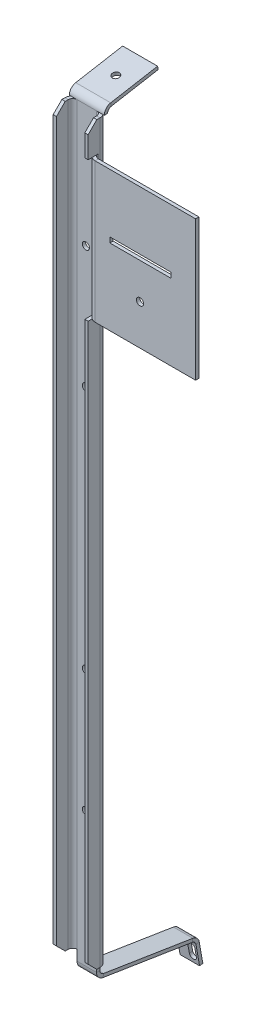
from build123d import *

# Parameters (mm, degrees)
SKETCH1_W                      = 20
SKETCH1_H                      = 425.14614931
BASE_FLANGE1_DEPTH             = 1.89738
EDGE_FLANGE1_START             = 74
EDGE_FLANGE1_DEPTH             = 20
EDGE_FLANGE1_2_DEPTH           = 20
EDGE_FLANGE3_STRIP_W           = 12.66952
EDGE_FLANGE3_STRIP_H           = 1.89738
EDGE_FLANGE3_STRIP_CUT_DEPTH   = 421.088186102
EDGE_FLANGE3_STRIP_2_W         = 12.66952
EDGE_FLANGE3_STRIP_2_H         = 1.89738
EDGE_FLANGE3_STRIP_CUT_2_DEPTH = 421.088186102
EDGE_FLANGE3_DEPTH             = 421.088186102
EDGE_FLANGE3_BEND_DEPTH        = 421.088186102
EDGE_FLANGE5_START             = 78.43738
EDGE_FLANGE5_DEPTH             = 11.12524
EDGE_FLANGE6_START             = 78.43738
EDGE_FLANGE6_DEPTH             = 11.12524
EDGE_FLANGE6_2_DEPTH           = 11.12524
SKETCH31_R                     = 2.04
CUT_EXTRUDE1_DEPTH             = 10
CUT_EXTRUDE2_DEPTH             = 3.21412
BREAK_CORNER1_START            = 74
BREAK_CORNER1_DEPTH            = 20
EDGE_FLANGE7_STRIP_W           = 14.16952
EDGE_FLANGE7_STRIP_H           = 1.89738
EDGE_FLANGE7_STRIP_CUT_DEPTH   = 80
EDGE_FLANGE7_DEPTH             = 80
SKETCH36_W                     = 35
SKETCH36_H                     = 3
CUT_EXTRUDE3_DEPTH             = 10
SKETCH37_R                     = 2.04
CUT_EXTRUDE4_DEPTH             = 10
SKETCH38_R                     = 2.04
CUT_EXTRUDE6_DEPTH             = 10


# Read off the part's stored shape, not the designer's step: Edge-Flange1, Edge-Flange5, Edge-Flange6, Break-Corner1
# Sheet-metal steps are written as plain solids
with BuildPart() as part:
    # Sketch1 → Base-Flange1 (new body)
    with BuildSketch(Plane.XY):
        with Locations((84, -2.062852184)):
            Rectangle(SKETCH1_W, SKETCH1_H)
    extrude(amount=-BASE_FLANGE1_DEPTH)

    # Edge-Flange1 outline → Edge-Flange1 (cut)
    with BuildSketch(Plane.YZ.offset(EDGE_FLANGE1_START)):
        with BuildLine():
            ThreePointArc((206.452259263, 0), (208.504014129, -0.502835143), (210.090767372, -1.89738))
            Line((210.090767372, -1.89738), (210.510222471, -1.89738))
            Line((210.510222471, -1.89738), (210.510222471, 0))
            Line((210.510222471, 0), (206.452259263, 0))
        make_face()
    extrude(amount=EDGE_FLANGE1_DEPTH, mode=Mode.SUBTRACT)

    # Edge-Flange1 2 outline → Edge-Flange1 2 (add)
    with BuildSketch(Plane.YZ.offset(EDGE_FLANGE1_START)):
        with BuildLine():
            Line((215.55374818, -30.500635662), (210.82222549, -3.666837049))
            ThreePointArc((210.82222549, -3.666837049), (210.553071361, -2.742186382), (210.090767372, -1.89738))
            Line((210.090767372, -1.89738), (206.452259263, -1.89738))
            ThreePointArc((206.452259263, -1.89738), (208.084939792, -2.491627114), (208.953670956, -3.996313629))
            Line((208.953670956, -3.996313629), (213.685193646, -30.830112242))
            Line((213.685193646, -30.830112242), (215.55374818, -30.500635662))
        make_face()
    extrude(amount=EDGE_FLANGE1_2_DEPTH)

    # Edge-Flange3 strip (across the edge) → Edge-Flange3 strip cut (cut)
    with BuildSketch(Plane(origin=(74, 206.452259263, 0), x_dir=(1, 0, 0), z_dir=(0, -1, 0))):
        with Locations((-1.89738, -0.94869)):
            Rectangle(EDGE_FLANGE3_STRIP_W, EDGE_FLANGE3_STRIP_H)
    extrude(amount=EDGE_FLANGE3_STRIP_CUT_DEPTH, mode=Mode.SUBTRACT)

    # Edge-Flange3 strip 2 (across the edge) → Edge-Flange3 strip cut 2 (cut)
    with BuildSketch(Plane(origin=(94, -214.635926839, 0), x_dir=(-1, 0, 0), z_dir=(0, 1, 0))):
        with Locations((-1.89738, -0.94869)):
            Rectangle(EDGE_FLANGE3_STRIP_2_W, EDGE_FLANGE3_STRIP_2_H)
    extrude(amount=EDGE_FLANGE3_STRIP_CUT_2_DEPTH, mode=Mode.SUBTRACT)

    # Edge-Flange3 section (across the edge) → Edge-Flange3 (add)
    with BuildSketch(Plane(origin=(74, 206.452259263, 0), x_dir=(1, 0, 0), z_dir=(0, -1, 0))):
        with BuildLine():
            Line((0, 2.54), (0, 9.26))
            Line((0, 9.26), (1.89738, 9.26))
            Line((1.89738, 9.26), (1.89738, 2.54))
            ThreePointArc((1.89738, 2.54), (2.641328776, 0.743948776), (4.43738, 0))
            Line((4.43738, 0), (4.43738, -1.89738))
            ThreePointArc((4.43738, -1.89738), (1.299678511, -0.597701489), (0, 2.54))
        make_face()
    extrude(amount=EDGE_FLANGE3_DEPTH)

    # Edge-Flange3 section 2 (across the edge) → Edge-Flange3 bend (add)
    with BuildSketch(Plane(origin=(94, -214.635926839, 0), x_dir=(-1, 0, 0), z_dir=(0, 1, 0))):
        with BuildLine():
            Line((0, 2.54), (0, 9.26))
            Line((0, 9.26), (1.89738, 9.26))
            Line((1.89738, 9.26), (1.89738, 2.54))
            ThreePointArc((1.89738, 2.54), (2.641328776, 0.743948776), (4.43738, 0))
            Line((4.43738, 0), (4.43738, -1.89738))
            ThreePointArc((4.43738, -1.89738), (1.299678511, -0.597701489), (0, 2.54))
        make_face()
    extrude(amount=EDGE_FLANGE3_BEND_DEPTH)

    # Edge-Flange5 outline → Edge-Flange5 (add)
    with BuildSketch(Plane.YZ.offset(EDGE_FLANGE5_START)):
        with BuildLine():
            ThreePointArc((-220.545530818, 0), (-223.427378599, -1.063169777), (-224.928279306, -3.743220834))
            Line((-224.928279306, -3.743220834), (-233.964581883, -60.796189915))
            Line((-233.964581883, -60.796189915), (-232.090561779, -61.09300554))
            Line((-232.090561779, -61.09300554), (-223.054259203, -4.040036459))
            ThreePointArc((-223.054259203, -4.040036459), (-222.195128861, -2.505948848), (-220.545530818, -1.89738))
            Line((-220.545530818, -1.89738), (-214.635926839, -1.89738))
            Line((-214.635926839, -1.89738), (-214.635926839, 0))
            Line((-214.635926839, 0), (-220.545530818, 0))
        make_face()
    extrude(amount=EDGE_FLANGE5_DEPTH)

    # Edge-Flange6 outline → Edge-Flange6 (cut)
    with BuildSketch(Plane.YZ.offset(EDGE_FLANGE6_START)):
        with BuildLine():
            ThreePointArc((-231.141243496, -55.099245789), (-231.958853079, -57.047079402), (-233.584451669, -58.3961422))
            Line((-233.584451669, -58.3961422), (-233.964581883, -60.796189915))
            Line((-233.964581883, -60.796189915), (-232.090561779, -61.09300554))
            Line((-232.090561779, -61.09300554), (-231.141243496, -55.099245789))
        make_face()
    extrude(amount=EDGE_FLANGE6_DEPTH, mode=Mode.SUBTRACT)

    # Edge-Flange6 2 outline → Edge-Flange6 2 (add)
    with BuildSketch(Plane.YZ.offset(EDGE_FLANGE6_START)):
        with BuildLine():
            Line((-246.408498712, -60.830152569), (-234.753449034, -58.775052849))
            ThreePointArc((-234.753449034, -58.775052849), (-234.155770092, -58.626260643), (-233.584451669, -58.3961422))
            Line((-233.584451669, -58.3961422), (-233.015263599, -54.802430164))
            ThreePointArc((-233.015263599, -54.802430164), (-233.712335844, -56.185396154), (-235.082925613, -56.906498315))
            Line((-235.082925613, -56.906498315), (-246.737975292, -58.961598035))
            Line((-246.737975292, -58.961598035), (-246.408498712, -60.830152569))
        make_face()
    extrude(amount=EDGE_FLANGE6_2_DEPTH)

    # Sketch31 → Cut-Extrude1 (cut)
    with BuildSketch(Plane(origin=(0, 203.838091474, 35.942155223), x_dir=(1, 0, 0), z_dir=(0, 0.9848077530122075, 0.17364817766693413))):
        with Locations(Location((84.110673768, 53.230127546, 0), (0, 0, 270))):
            Circle(SKETCH31_R)
    extrude(amount=-CUT_EXTRUDE1_DEPTH, mode=Mode.SUBTRACT)

    # Sketch32 → Cut-Extrude2 (cut)
    with BuildSketch(Plane(origin=(0, 2.642966784, -14.989009472), x_dir=(1, 0, 0), z_dir=(0, -0.17364817766693053, 0.984807753012208))):
        with BuildLine():
            Line((84.41238, -249.228045081), (84.41238, -244.228045081))
            ThreePointArc((84.41238, -244.228045081), (86.43738, -242.203045081), (88.46238, -244.228045081))
            Line((88.46238, -244.228045081), (88.46238, -249.228045081))
            ThreePointArc((88.46238, -249.228045081), (86.43738, -251.253045081), (84.41238, -249.228045081))
        make_face()
    extrude(amount=-CUT_EXTRUDE2_DEPTH, mode=Mode.SUBTRACT)

    # Break-Corner1 outline → Break-Corner1 (cut)
    with BuildSketch(Plane.YZ.offset(BREAK_CORNER1_START)):
        Polygon((-214.635926839, 9.26), (-214.635926839, 4.26), (-209.635926839, 9.26), align=None)
        Polygon((206.452259263, 9.26), (201.452259263, 9.26), (206.452259263, 4.26), align=None)
    extrude(amount=BREAK_CORNER1_DEPTH, mode=Mode.SUBTRACT)

    # Edge-Flange7 strip (across the edge) → Edge-Flange7 strip cut (cut)
    with BuildSketch(Plane(origin=(94, 189.043786616, 7.76), x_dir=(0, 0, -1), z_dir=(0, -1, 0))):
        with Locations((-2.64738, -0.94869)):
            Rectangle(EDGE_FLANGE7_STRIP_W, EDGE_FLANGE7_STRIP_H)
    extrude(amount=EDGE_FLANGE7_STRIP_CUT_DEPTH, mode=Mode.SUBTRACT)

    # Edge-Flange7 section (across the edge) → Edge-Flange7 (add)
    with BuildSketch(Plane(origin=(94, 189.043786616, 7.76), x_dir=(0, 0, -1), z_dir=(0, -1, 0))):
        with BuildLine():
            Line((0, 2.54), (0, 60))
            Line((0, 60), (1.89738, 60))
            Line((1.89738, 60), (1.89738, 2.54))
            ThreePointArc((1.89738, 2.54), (2.641328776, 0.743948776), (4.43738, 0))
            Line((4.43738, 0), (4.43738, -1.89738))
            ThreePointArc((4.43738, -1.89738), (1.299678511, -0.597701489), (0, 2.54))
        make_face()
    extrude(amount=EDGE_FLANGE7_DEPTH)

    # Sketch36 → Cut-Extrude3 (cut)
    with BuildSketch(Plane.XY.offset(7.76)):
        with Locations((122.44, 154.043786616)):
            Rectangle(SKETCH36_W, SKETCH36_H)
    extrude(amount=-CUT_EXTRUDE3_DEPTH, mode=Mode.SUBTRACT)

    # Sketch37 → Cut-Extrude4 (cut)
    with BuildSketch(Plane.XY):
        with Locations((83.43738, 136.452259263)):
            Circle(SKETCH37_R)
        with Locations((83.43738, 66.452259263)):
            Circle(SKETCH37_R)
        with Locations((83.43738, -73.547740737)):
            Circle(SKETCH37_R)
        with Locations((83.43738, -143.547740737)):
            Circle(SKETCH37_R)
    extrude(amount=-CUT_EXTRUDE4_DEPTH, mode=Mode.SUBTRACT)

    # Sketch38 → Cut-Extrude6 (cut)
    with BuildSketch(Plane.XY.offset(7.76)):
        with Locations((122.195161073, 132.04291448)):
            Circle(SKETCH38_R)
    extrude(amount=-CUT_EXTRUDE6_DEPTH, mode=Mode.SUBTRACT)


solid = part.part
